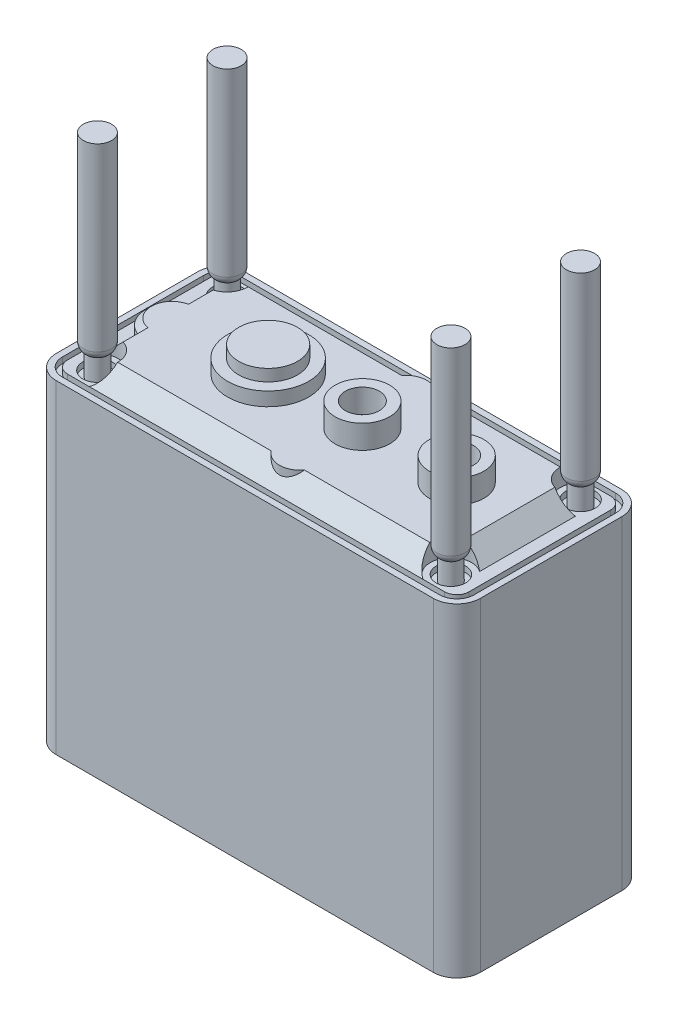
from build123d import *

# Parameters (mm, degrees)
SKETCH1_W           = 57.15
SKETCH1_H           = 25.4
BOSS_EXTRUDE1_DEPTH = 43.65625
FILLET1_R           = 3.175
CUT_EXTRUDE1_DEPTH  = 0.79375
SKETCH3_R           = 1.984375
CUT_EXTRUDE2_DEPTH  = 0.79375
BOSS_EXTRUDE2_DEPTH = 2.38125
CHAMFER1_SIZE       = 2.38125
SKETCH5_R           = 2.778125
SKETCH5_R_2         = 3.571875
BOSS_EXTRUDE3_DEPTH = 2.38125
CHAMFER2_SIZE       = 0.79375
SKETCH6_R           = 3.683
SKETCH6_R_2         = 2.286
BOSS_EXTRUDE4_DEPTH = 3.175
SKETCH7_R           = 5.461
BOSS_EXTRUDE5_DEPTH = 3.429
SKETCH8_R           = 1.27
BOSS_EXTRUDE6_DEPTH = 3.175
SKETCH9_R           = 1.905
BOSS_EXTRUDE7_DEPTH = 25.4
FILLET2_R           = 1.27
CUT_EXTRUDE3_START  = -1.5875
SKETCH10_R          = 5.461
SKETCH10_R_2        = 3.96875
CUT_EXTRUDE3_DEPTH  = 1.5875


# Some blends are built 0.0001 mm under size
with BuildPart() as part:
    # Sketch1 → Boss-Extrude1 (new body)
    with BuildSketch(Plane(origin=(0, 0, 0), x_dir=(1, 0, 0), z_dir=(0, 1, 0))):
        Rectangle(SKETCH1_W, SKETCH1_H)
    extrude(amount=BOSS_EXTRUDE1_DEPTH)

    # Fillet1
    fillet1_edges = [part.edges().sort_by_distance(p)[0] for p in [
        (28.575, 21.828125, 12.7),
        (-28.575, 21.828125, 12.7),
        (-28.575, 21.828125, -12.7),
        (28.575, 21.828125, -12.7),
    ]]
    fillet(fillet1_edges, radius=FILLET1_R)

    # Sketch2 → Cut-Extrude1 (cut)
    with BuildSketch(Plane(origin=(0, 43.65625, 0), x_dir=(1, 0, 0), z_dir=(0, 1, 0))):
        with BuildLine():
            Line((25.4, 11.8745), (-25.4, 11.8745))
            ThreePointArc((-25.4, 11.8745), (-27.061347382, 11.186347382), (-27.7495, 9.525))
            Line((-27.7495, 9.525), (-27.7495, -9.525))
            ThreePointArc((-27.7495, -9.525), (-27.061347382, -11.186347382), (-25.4, -11.8745))
            Line((-25.4, -11.8745), (25.4, -11.8745))
            ThreePointArc((25.4, -11.8745), (27.061347382, -11.186347382), (27.7495, -9.525))
            Line((27.7495, -9.525), (27.7495, 9.525))
            ThreePointArc((27.7495, 9.525), (27.061347382, 11.186347382), (25.4, 11.8745))
        make_face()
        with BuildLine():
            Line((25.4, 11.176), (-25.4, 11.176))
            ThreePointArc((-25.4, 11.176), (-26.567433296, 10.692433296), (-27.051, 9.525))
            Line((-27.051, 9.525), (-27.051, -9.525))
            ThreePointArc((-27.051, -9.525), (-26.567433296, -10.692433296), (-25.4, -11.176))
            Line((-25.4, -11.176), (25.4, -11.176))
            ThreePointArc((25.4, -11.176), (26.567433296, -10.692433296), (27.051, -9.525))
            Line((27.051, -9.525), (27.051, 9.525))
            ThreePointArc((27.051, 9.525), (26.567433296, 10.692433296), (25.4, 11.176))
        make_face(mode=Mode.SUBTRACT)
    extrude(amount=-CUT_EXTRUDE1_DEPTH, mode=Mode.SUBTRACT)

    # Sketch3 → Cut-Extrude2 (cut)
    with BuildSketch(Plane(origin=(0, 43.65625, 0), x_dir=(1, 0, 0), z_dir=(0, 1, 0))):
        with Locations(Location((-23.8125, 8.73125, 0), (0, 0, 270))):
            Circle(SKETCH3_R)
        with Locations(Location((-23.8125, -8.73125, 0), (0, 0, 270))):
            Circle(SKETCH3_R)
        with Locations(Location((23.8125, -8.73125, 0), (0, 0, 270))):
            Circle(SKETCH3_R)
        with Locations(Location((23.8125, 8.73125, 0), (0, 0, 270))):
            Circle(SKETCH3_R)
    extrude(amount=-CUT_EXTRUDE2_DEPTH, mode=Mode.SUBTRACT)

    # Sketch4 → Boss-Extrude2 (add)
    with BuildSketch(Plane(origin=(0, 43.65625, 0), x_dir=(1, 0, 0), z_dir=(0, 1, 0))):
        with BuildLine():
            Line((22.492963736, -11.176), (-22.492963736, -11.176))
            ThreePointArc((-22.492963736, -11.176), (-21.446391914, -7.275395941), (-25.4, -6.4513767))
            Line((-25.4, -6.4513767), (-25.4, 6.4513767))
            ThreePointArc((-25.4, 6.4513767), (-21.446391914, 7.275395941), (-22.492963736, 11.176))
            Line((-22.492963736, 11.176), (22.492963736, 11.176))
            ThreePointArc((22.492963736, 11.176), (21.446391914, 7.275395941), (25.4, 6.4513767))
            Line((25.4, 6.4513767), (25.4, -6.4513767))
            ThreePointArc((25.4, -6.4513767), (21.446391914, -7.275395941), (22.492963736, -11.176))
        make_face()
    extrude(amount=BOSS_EXTRUDE2_DEPTH)

    # Chamfer1
    chamfer1_edges = [part.edges().sort_by_distance(p)[0] for p in [
        (25.4, 46.0375, 0),
        (0, 46.0375, -11.176),
        (-25.4, 46.0375, 0),
        (0, 46.0375, 11.176),
    ]]
    chamfer(chamfer1_edges, length=CHAMFER1_SIZE - 0.0001)  # a hair under: the kernel refuses the full size

    # Sketch5 → Boss-Extrude3 (add)
    with BuildSketch(Plane(origin=(0, 46.0375, 0), x_dir=(1, 0, 0), z_dir=(0, 1, 0))):
        with Locations((1.905, 7.14375)):
            Circle(SKETCH5_R)
        with Locations((1.905, -7.14375)):
            Circle(SKETCH5_R)
        with Locations((-22.51075, 0)):
            Circle(SKETCH5_R_2)
    extrude(amount=-BOSS_EXTRUDE3_DEPTH)

    # Chamfer2
    chamfer2_edges = [part.edges().sort_by_distance(p)[0] for p in [
        (-26.082625, 46.0375, 0),
    ]]
    chamfer(chamfer2_edges, length=CHAMFER2_SIZE)

    # Sketch6 → Boss-Extrude4 (add)
    # profile 1 of 2: a face of its own
    with BuildSketch(Plane(origin=(0, 46.0375, 0), x_dir=(1, 0, 0), z_dir=(0, 1, 0))):
        with Locations(Location((3.15087, 0, 0), (0, 0, 270))):
            Circle(SKETCH6_R)
        with Locations(Location((3.15087, 0, 0), (0, 0, 270))):
            Circle(SKETCH6_R_2, mode=Mode.SUBTRACT)
    # profile 2 of 2: a face of its own
    with BuildSketch(Plane(origin=(0, 46.0375, 0), x_dir=(1, 0, 0), z_dir=(0, 1, 0))):
        with Locations(Location((15.85087, 0, 0), (0, 0, 270))):
            Circle(SKETCH6_R)
        with Locations(Location((15.85087, 0, 0), (0, 0, 270))):
            Circle(SKETCH6_R_2, mode=Mode.SUBTRACT)
    extrude(amount=BOSS_EXTRUDE4_DEPTH)

    # Sketch7 → Boss-Extrude5 (add)
    with BuildSketch(Plane(origin=(0, 46.0375, 0), x_dir=(1, 0, 0), z_dir=(0, 1, 0))):
        with Locations(Location((-9.54913, 0, 0), (0, 0, 270))):
            Circle(SKETCH7_R)
    extrude(amount=BOSS_EXTRUDE5_DEPTH)

    # Sketch8 → Boss-Extrude6 (add)
    with BuildSketch(Plane(origin=(0, 42.8625, 0), x_dir=(1, 0, 0), z_dir=(0, 1, 0))):
        with Locations(Location((-23.8125, -8.73125, 0), (0, 0, 270))):
            Circle(SKETCH8_R)
        with Locations(Location((23.8125, -8.73125, 0), (0, 0, 270))):
            Circle(SKETCH8_R)
        with Locations(Location((23.8125, 8.73125, 0), (0, 0, 270))):
            Circle(SKETCH8_R)
        with Locations(Location((-23.8125, 8.73125, 0), (0, 0, 270))):
            Circle(SKETCH8_R)
    extrude(amount=BOSS_EXTRUDE6_DEPTH)

    # Sketch9 → Boss-Extrude7 (add)
    with BuildSketch(Plane(origin=(0, 46.0375, 0), x_dir=(1, 0, 0), z_dir=(0, 1, 0))):
        with Locations(Location((-23.8125, -8.73125, 0), (0, 0, 270))):
            Circle(SKETCH9_R)
        with Locations(Location((-23.8125, 8.73125, 0), (0, 0, 270))):
            Circle(SKETCH9_R)
        with Locations(Location((23.8125, 8.73125, 0), (0, 0, 270))):
            Circle(SKETCH9_R)
        with Locations(Location((23.8125, -8.73125, 0), (0, 0, 270))):
            Circle(SKETCH9_R)
    extrude(amount=BOSS_EXTRUDE7_DEPTH)

    # Fillet2
    # the kernel refuses this fillet: 1.27 mm, written as the material it takes off along each edge
    with BuildSketch(Plane(origin=(23.8125, 46.0375, 8.73125), x_dir=(0, 0, 1), z_dir=(-1, 0, 0))) as fillet2_piece_1:
        with BuildLine():
            CenterArc((0.635, 1.099852263), FILLET2_R, 300, 60)
            Line((1.905, 1.099852263), (1.9304, 1.099852263))
            Line((1.9304, 1.099852263), (1.9304, 0))
            Line((1.9304, 0), (1.905, -0.0254))
            ThreePointArc((1.905, -0.0254), (1.5875, -0.0254), (1.2827, -0.021997045))
            Line((1.2827, -0.021997045), (1.27, 0))
        make_face()
    revolve(axis=Axis((23.8125, 46.0375, 8.73125), (0, 1, 0)), mode=Mode.SUBTRACT)
    with BuildSketch(Plane(origin=(23.8125, 46.0375, -8.73125), x_dir=(0, 0, 1), z_dir=(-1, 0, 0))) as fillet2_piece_2:
        with BuildLine():
            CenterArc((0.635, 1.099852263), FILLET2_R, 300, 60)
            Line((1.905, 1.099852263), (1.9304, 1.099852263))
            Line((1.9304, 1.099852263), (1.9304, 0))
            Line((1.9304, 0), (1.905, -0.0254))
            ThreePointArc((1.905, -0.0254), (1.5875, -0.0254), (1.2827, -0.021997045))
            Line((1.2827, -0.021997045), (1.27, 0))
        make_face()
    revolve(axis=Axis((23.8125, 46.0375, -8.73125), (0, 1, 0)), mode=Mode.SUBTRACT)
    with BuildSketch(Plane(origin=(-23.8125, 46.0375, -8.73125), x_dir=(0, 0, 1), z_dir=(-1, 0, 0))) as fillet2_piece_3:
        with BuildLine():
            CenterArc((0.635, 1.099852263), FILLET2_R, 300, 60)
            Line((1.905, 1.099852263), (1.9304, 1.099852263))
            Line((1.9304, 1.099852263), (1.9304, 0))
            Line((1.9304, 0), (1.905, -0.0254))
            ThreePointArc((1.905, -0.0254), (1.5875, -0.0254), (1.2827, -0.021997045))
            Line((1.2827, -0.021997045), (1.27, 0))
        make_face()
    revolve(axis=Axis((-23.8125, 46.0375, -8.73125), (0, 1, 0)), mode=Mode.SUBTRACT)
    with BuildSketch(Plane(origin=(-23.8125, 46.0375, 8.73125), x_dir=(0, 0, 1), z_dir=(-1, 0, 0))) as fillet2_piece_4:
        with BuildLine():
            CenterArc((0.635, 1.099852263), FILLET2_R, 300, 60)
            Line((1.27, 0), (1.2827, -0.021997045))
            ThreePointArc((1.2827, -0.021997045), (1.5875, -0.0254), (1.905, -0.0254))
            Line((1.905, -0.0254), (1.9304, 0))
            Line((1.9304, 0), (1.9304, 1.099852263))
            Line((1.9304, 1.099852263), (1.905, 1.099852263))
        make_face()
    revolve(axis=Axis((-23.8125, 46.0375, 8.73125), (0, 1, 0)), mode=Mode.SUBTRACT)

    # Sketch10 → Cut-Extrude3 (cut)
    with BuildSketch(Plane(origin=(0, 49.4665, 0), x_dir=(1, 0, 0), z_dir=(0, 1, 0)).offset(CUT_EXTRUDE3_START)):
        with Locations(Location((-9.54913, 0, 0), (0, 0, 270))):
            Circle(SKETCH10_R)
        with Locations(Location((-9.54913, 0, 0), (0, 0, 270))):
            Circle(SKETCH10_R_2, mode=Mode.SUBTRACT)
    extrude(amount=CUT_EXTRUDE3_DEPTH, mode=Mode.SUBTRACT)


solid = part.part
